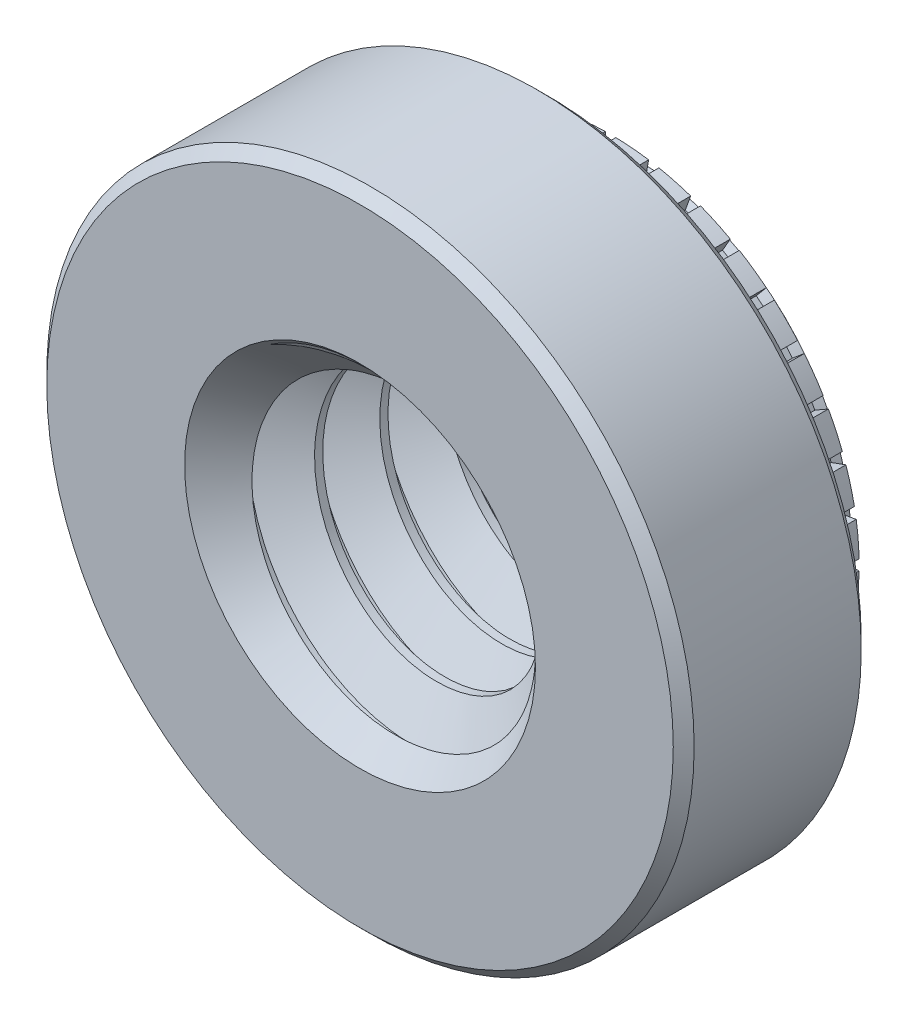
from build123d import *

# Parameters (mm, degrees)
SKETCH1_R               = 3.937
EXTRUDE1_DEPTH          = 2.286
SKETCH2_R               = 3.0226
EXTRUDE2_DEPTH          = 1.016
SKETCH3_W               = 0.127
SKETCH3_H               = 1.1049
CUT_EXTRUDE_THIN1_DEPTH = 1.016
CIRPATTERN1_COUNT       = 36
SKETCH5_OUTSIDE_W       = 12.382
SKETCH5_OUTSIDE_H       = 12.382
SKETCH5_OUTSIDE_R       = 2.667
CUT_EXTRUDE1_DEPTH      = 0.254
CUT_EXTRUDE1_DRAFT      = 20
CHAMFER2_SIZE           = 0.127
SKETCH7_R               = 2.0828
CUT_EXTRUDE3_DEPTH      = 7.473263628
SWEEP1_PITCH            = 0.79375
SKETCH10_R              = 3.937
CUT_EXTRUDE4_DEPTH      = 7.85372784
SKETCH11_R              = 2.667
CUT_EXTRUDE5_DEPTH      = 7.473263679


with BuildPart() as part:
    # Sketch1 → Extrude1 (new body)
    with BuildSketch(Plane.XY):
        Circle(SKETCH1_R)
    extrude(amount=-EXTRUDE1_DEPTH)

    # Sketch2 → Extrude2 (add)
    with BuildSketch(Plane(origin=(0, 0, -2.286), x_dir=(-1, 0, 0), z_dir=(0, 0, -1))):
        with Locations(Location((0, 0, 0), (0, 0, 180))):
            Circle(SKETCH2_R)
    extrude(amount=EXTRUDE2_DEPTH)

    # Sketch3 → Cut-Extrude-Thin1 (cut)
    with BuildSketch(Plane(origin=(0, 0, -3.302), x_dir=(-1, 0, 0), z_dir=(0, 0, -1))):
        with Locations((0, 3.38455)):
            Rectangle(SKETCH3_W, SKETCH3_H)
    cut_extrude_thin1 = extrude(amount=-CUT_EXTRUDE_THIN1_DEPTH, mode=Mode.SUBTRACT)

    # CirPattern1: Cut-Extrude-Thin1 ×36 about axis
    cirpattern1_axis = Axis((0, 0, 0), (0, 0, 1))
    for i in range(1, CIRPATTERN1_COUNT):
        add(cut_extrude_thin1.rotate(cirpattern1_axis, i * 360 / CIRPATTERN1_COUNT), mode=Mode.SUBTRACT)


with BuildPart() as cut_extrude1_tool:
    # Sketch5 outside → Cut-Extrude1 (with draft: the straight prism first)
    with BuildSketch(Plane(origin=(0, 0, -3.302), x_dir=(-1, 0, 0), z_dir=(0, 0, -1))):
        Rectangle(SKETCH5_OUTSIDE_W, SKETCH5_OUTSIDE_H)
        Circle(SKETCH5_OUTSIDE_R, mode=Mode.SUBTRACT)
    extrude(amount=-CUT_EXTRUDE1_DEPTH)
    # Cut-Extrude1: the draft: its side faces are tilted about the plane it starts from
    cut_extrude1_sides = [cut_extrude1_tool.faces().sort_by_distance(p)[0] for p in [
        (0, -6.191, -3.175),
        (-6.191, 0, -3.175),
        (0, 6.191, -3.175),
        (6.191, 0, -3.175),
        (2.667, 0, -3.175),
    ]]
    draft(cut_extrude1_sides, Plane(origin=(0, 0, -3.302), x_dir=(-1, 0, 0), z_dir=(0, 0, -1)), CUT_EXTRUDE1_DRAFT)


with BuildPart() as part_1:
    add(part.part)

    # Cut-Extrude1: cut by cut_extrude1_tool
    add(cut_extrude1_tool.part, mode=Mode.SUBTRACT)

    # Chamfer2
    chamfer2_edges = [part_1.edges().sort_by_distance(p)[0] for p in [
        (-3.937, 0, 0),
        (-3.937, 0, -2.286),
    ]]
    chamfer(chamfer2_edges, length=CHAMFER2_SIZE)

    # Sketch7 → Cut-Extrude3 (cut, through all)
    with BuildSketch(Plane.XY):
        Circle(SKETCH7_R)
    extrude(amount=-CUT_EXTRUDE3_DEPTH, mode=Mode.SUBTRACT)

    # Sweep1: the profile of Sketch9 profile screwed along a right-hand helix of 8.16 turns, 6 arcs to a turn; built about Z, then put on its axis
    sweep1_z = Axis((0, 0, 0), (0, 0, 1))
    sweep1_corners = [(2.0831, 0, -0.694704455), (1.567244252, 0, -0.396875), (1.567244252, 0, -0.29765625), (2.0831, 0, 0.000173205)]
    with BuildLine(mode=Mode.PRIVATE) as sweep1_profile:
        Line(sweep1_corners[0], sweep1_corners[1])
        Line(sweep1_corners[1], sweep1_corners[2])
        Line(sweep1_corners[2], sweep1_corners[3])
        Line(sweep1_corners[3], sweep1_corners[0])
    sweep1_cap = Face(sweep1_profile.wire())
    sweep1_turn_angles = [0, 30, 60, 90, 120, 150, 180, 210, 240, 270, 300, 330, 360]
    sweep1_turn_weights = [1, 0.8660254037844387, 1, 0.8660254037844387, 1, 0.8660254037844387, 1, 0.8660254037844387, 1, 0.8660254037844387, 1, 0.8660254037844387, 1]
    sweep1_turn_rails = [Edge.make_bspline([Vector(p[0], p[1], 0).rotate(sweep1_z, sweep1_turn_angles[k]) / sweep1_turn_weights[k] + Vector(0, 0, p[2] + SWEEP1_PITCH * sweep1_turn_angles[k] / 360) for k in range(13)], [0, 0, 0, 1, 1, 2, 2, 3, 3, 4, 4, 5, 5, 6, 6, 6], 2, sweep1_turn_weights) for p in sweep1_corners]
    sweep1_turn_sides = [Face.make_surface_from_curves(sweep1_turn_rails[p[0]], sweep1_turn_rails[p[1]]) for p in [(0, 1), (1, 2), (2, 3), (3, 0)]]
    sweep1_turn = Solid(Shell([*sweep1_turn_sides, sweep1_cap, sweep1_cap.rotate(sweep1_z, 360).moved(Location((0, 0, SWEEP1_PITCH * 360 / 360)))]))
    sweep1_last_angles = [2880, 2908.8, 2937.6]
    sweep1_last_weights = [1, 0.8763066800438487, 1]
    sweep1_last_rails = [Edge.make_bspline([Vector(p[0], p[1], 0).rotate(sweep1_z, sweep1_last_angles[k]) / sweep1_last_weights[k] + Vector(0, 0, p[2] + SWEEP1_PITCH * sweep1_last_angles[k] / 360) for k in range(3)], [0, 0, 0, 1, 1, 1], 2, sweep1_last_weights) for p in sweep1_corners]
    sweep1_last_sides = [Face.make_surface_from_curves(sweep1_last_rails[p[0]], sweep1_last_rails[p[1]]) for p in [(0, 1), (1, 2), (2, 3), (3, 0)]]
    sweep1_last = Solid(Shell([*sweep1_last_sides, sweep1_cap.rotate(sweep1_z, 2880).moved(Location((0, 0, SWEEP1_PITCH * 2880 / 360))), sweep1_cap.rotate(sweep1_z, 2937.6).moved(Location((0, 0, SWEEP1_PITCH * 2937.6 / 360)))]))
    sweep1_each = [*[sweep1_turn.moved(Location((0, 0, SWEEP1_PITCH * i))) for i in range(8)], sweep1_last]
    add(Plane(origin=(0, 0, -3.302), x_dir=(0, 1, 0), z_dir=(0, 0, 1)) * Compound([sweep1_each[i] for i in range(0, 9, 2)]))
    add(Plane(origin=(0, 0, -3.302), x_dir=(0, 1, 0), z_dir=(0, 0, 1)) * Compound([sweep1_each[i] for i in range(1, 9, 2)]))

    # Sketch10 → Cut-Extrude4 (cut, through all)
    with BuildSketch(Plane.XY):
        Circle(SKETCH10_R)
    extrude(amount=CUT_EXTRUDE4_DEPTH, mode=Mode.SUBTRACT)

    # Sketch11 → Cut-Extrude5 (cut, through all)
    with BuildSketch(Plane(origin=(0, 0, -3.302), x_dir=(-1, 0, 0), z_dir=(0, 0, -1))):
        Circle(SKETCH11_R)
    extrude(amount=CUT_EXTRUDE5_DEPTH, mode=Mode.SUBTRACT)

    # Cut-Extrude6 cone 1 section (through the dimple's axis) → Cut-Extrude6 (revolve, cut)
    with BuildSketch(Plane(origin=(0, 0, 0), x_dir=(0, -1, 0), z_dir=(1, 0, 0))):
        Polygon((0, 0), (2.1336, 0), (0, 2.1336), align=None)
    revolve(axis=Axis((0, 0, 0), (0, 0, -1)), mode=Mode.SUBTRACT)

    # Cut-Extrude7 cone 1 section (through the dimple's axis) → Cut-Extrude7 (revolve, cut)
    with BuildSketch(Plane(origin=(0, 0, -3.302), x_dir=(0, 1, 0), z_dir=(1, 0, 0))):
        Polygon((0, 0), (2.1336, 0), (0, 2.1336), align=None)
    revolve(axis=Axis((0, 0, -3.302), (0, 0, 1)), mode=Mode.SUBTRACT)


solid = part_1.part
